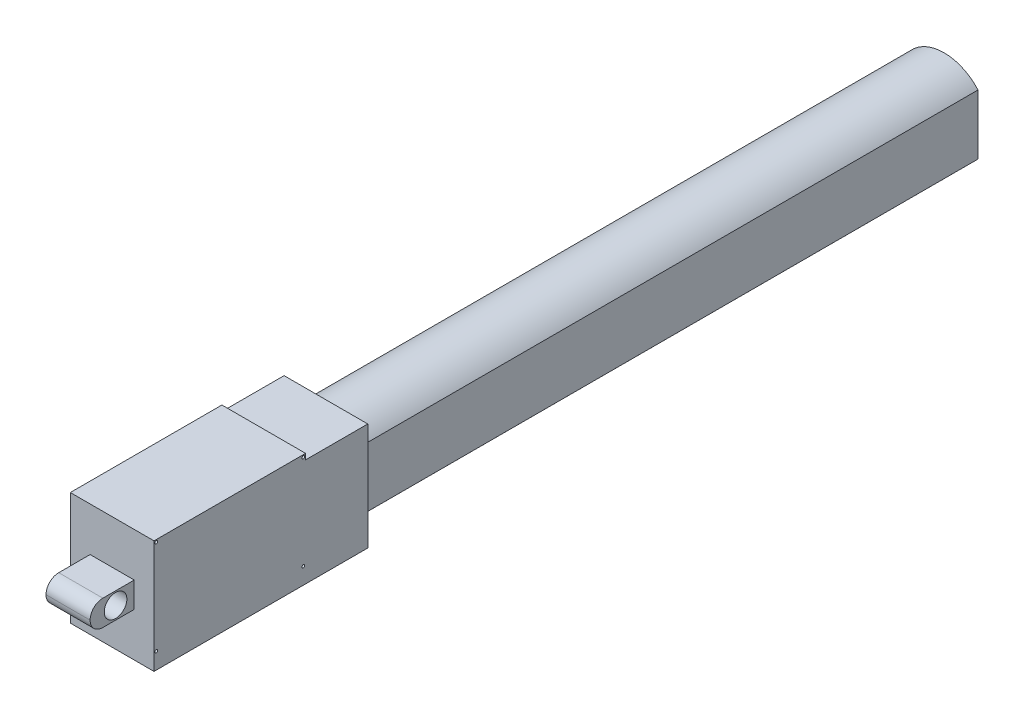
from build123d import *

# Parameters (mm, degrees)
BOSS_EXTRUDE2_DEPTH = 109.3
SKETCH4_W           = 14.8
SKETCH4_H           = 19
BOSS_EXTRUDE3_DEPTH = 11
SKETCH5_W           = 14.8
SKETCH5_H           = 20
BOSS_EXTRUDE4_DEPTH = 25.4
SKETCH7_W           = 14.8
SKETCH7_H           = 20
BOSS_EXTRUDE5_DEPTH = 1.4
SKETCH8_W           = 7.8
SKETCH8_H           = 4.5
BOSS_EXTRUDE6_DEPTH = 7.8
SKETCH9_R           = 2
CUT_EXTRUDE1_DEPTH  = 156.666149178
FILLET1_R           = 2.25
SKETCH10_R          = 0.25
CUT_EXTRUDE2_DEPTH  = 156.95928956


with BuildPart() as part:
    # Sketch3 → Boss-Extrude2 (new body)
    with BuildSketch(Plane.XY):
        with BuildLine():
            Line((-6, -5.291502622), (-6, 5.291502622))
            ThreePointArc((-6, 5.291502622), (0, 8), (6, 5.291502622))
            Line((6, 5.291502622), (6, -5.291502622))
            ThreePointArc((6, -5.291502622), (0, -8), (-6, -5.291502622))
        make_face()
        with BuildLine():
            Line((-3.05, -3.308700651), (-3.05, 3.308700651))
            ThreePointArc((-3.05, 3.308700651), (0, 4.5), (3.05, 3.308700651))
            Line((3.05, 3.308700651), (3.05, -3.308700651))
            ThreePointArc((3.05, -3.308700651), (0, -4.5), (-3.05, -3.308700651))
        make_face(mode=Mode.SUBTRACT)
    extrude(amount=BOSS_EXTRUDE2_DEPTH)

    # Sketch4 → Boss-Extrude3 (add)
    with BuildSketch(Plane.XY.offset(109.3)):
        Rectangle(SKETCH4_W, SKETCH4_H)
        with BuildLine():
            Line((-3.05, 3.308700651), (-3.05, -3.308700651))
            ThreePointArc((-3.05, -3.308700651), (0, -4.5), (3.05, -3.308700651))
            Line((3.05, -3.308700651), (3.05, 3.308700651))
            ThreePointArc((3.05, 3.308700651), (0, 4.5), (-3.05, 3.308700651))
        make_face(mode=Mode.SUBTRACT)
    extrude(amount=BOSS_EXTRUDE3_DEPTH)

    # Sketch5 → Boss-Extrude4 (add)
    with BuildSketch(Plane.XY.offset(120.3)):
        with Locations((0, 0.5)):
            Rectangle(SKETCH5_W, SKETCH5_H)
        with BuildLine():
            Line((-3.05, 3.308700651), (-3.05, -3.308700651))
            ThreePointArc((-3.05, -3.308700651), (0, -4.5), (3.05, -3.308700651))
            Line((3.05, -3.308700651), (3.05, 3.308700651))
            ThreePointArc((3.05, 3.308700651), (0, 4.5), (-3.05, 3.308700651))
        make_face(mode=Mode.SUBTRACT)
    extrude(amount=BOSS_EXTRUDE4_DEPTH)

    # Sketch7 → Boss-Extrude5 (add)
    with BuildSketch(Plane.XY.offset(145.7)):
        with Locations((0, 0.5)):
            Rectangle(SKETCH7_W, SKETCH7_H)
    extrude(amount=BOSS_EXTRUDE5_DEPTH)

    # Sketch8 → Boss-Extrude6 (add)
    with BuildSketch(Plane.XY.offset(147.1)):
        with Locations((0, 0.5)):
            Rectangle(SKETCH8_W, SKETCH8_H)
    extrude(amount=BOSS_EXTRUDE6_DEPTH)

    # Sketch9 → Cut-Extrude1 (cut, through all)
    with BuildSketch(Plane.ZY.offset(3.9)):
        with Locations((150.4, 0.5)):
            Circle(SKETCH9_R)
    extrude(amount=-CUT_EXTRUDE1_DEPTH, mode=Mode.SUBTRACT)

    # Fillet1
    fillet1_edges = [part.edges().sort_by_distance(p)[0] for p in [
        (0, -1.75, 154.9),
        (0, 2.75, 154.9),
    ]]
    fillet(fillet1_edges, radius=FILLET1_R - 0.0001)  # a hair under: the kernel refuses the full size

    # Sketch10 → Cut-Extrude2 (cut, through all)
    with BuildSketch(Plane.ZY.offset(7.4)):
        with Locations((120.7, -6.6)):
            Circle(SKETCH10_R)
        with Locations((146.7, -6.6)):
            Circle(SKETCH10_R)
        with Locations((120.7, 10.1)):
            Circle(SKETCH10_R)
        with Locations((146.7, 10.1)):
            Circle(SKETCH10_R)
    extrude(amount=-CUT_EXTRUDE2_DEPTH, mode=Mode.SUBTRACT)


solid = part.part
